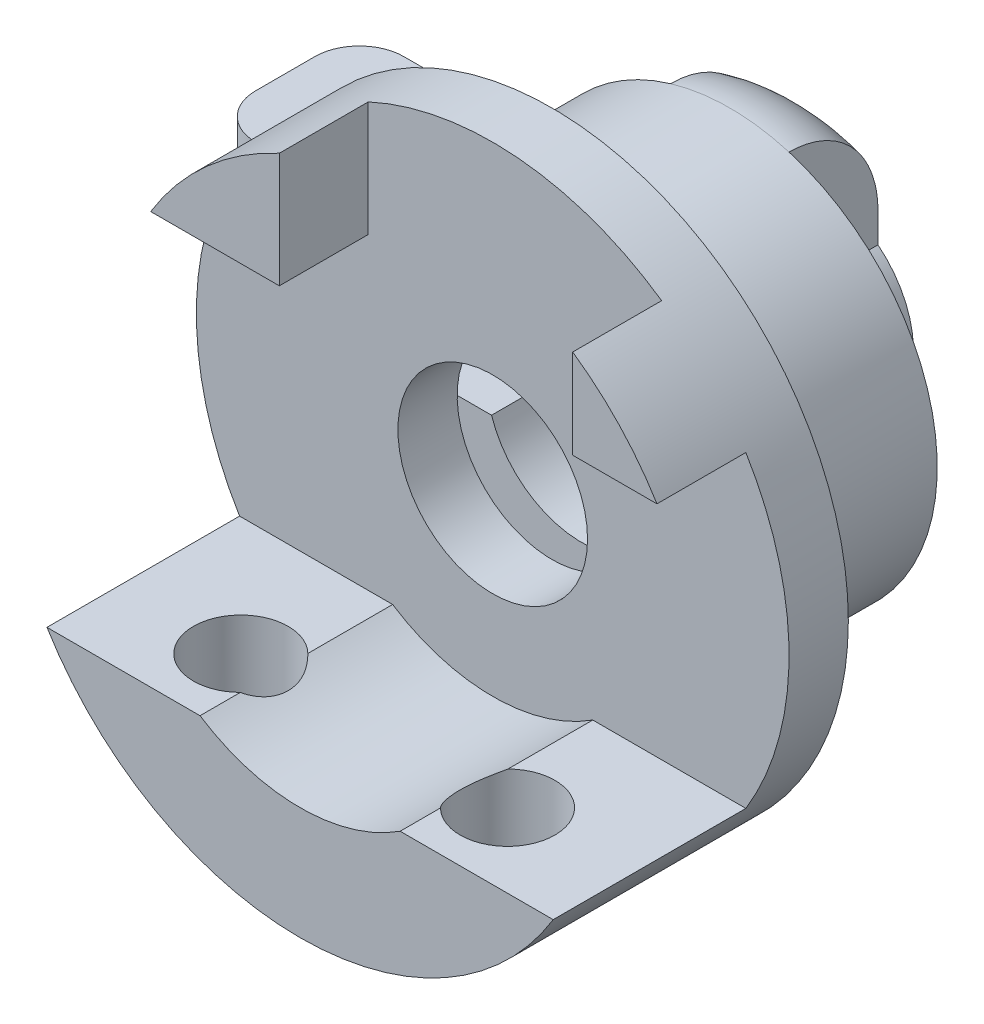
from build123d import *
from build123d.topology import SkipClean

# Parameters (mm, degrees)
SKETCH_1_R          = 10
EXTRUDE_1_DEPTH     = 2
EXTRUDE_2_DEPTH     = 3
SKETCH_3_R          = 3.2
CUT_EXTRUDE_1_DEPTH = 3
EXTRUDE_3_DEPTH     = 1
SKETCH_6_R          = 7
SKETCH_6_R_2        = 3.2
EXTRUDE_4_DEPTH     = 5
SKETCH_7_W          = 8.062767077
SKETCH_7_H          = 6
EXTRUDE_5_DEPTH     = 5
SKETCH_8_R          = 1.5
CUT_EXTRUDE_3_DEPTH = 20.006577809
CUT_EXTRUDE_4_DEPTH = 5
FILLET_7_R          = 1.5
EXTRUDE_6_DEPTH     = 3
EXTRUDE_START       = -2
SKETCH_12_R         = 3.2
EXTRUDE_7_DEPTH     = 2
FILLET_8_R          = 3
EXTRUDE_8_DEPTH     = 3.5
SKETCH_14_R         = 1.6
CUT_EXTRUDE_5_DEPTH = 22.640009284


with BuildPart() as part:
    # 草图1 → 凸台-拉伸1 (new body)
    with BuildSketch(Plane.XY):
        Circle(SKETCH_1_R)
    extrude(amount=EXTRUDE_1_DEPTH)

    # 草图2 → 凸台-拉伸2 (add)
    with SkipClean():  # the faces are left unmerged after this step: merging them gives an invalid solid
        with BuildSketch(Plane.XY.offset(2)):
            with BuildLine():
                Line((3.376388603, -5.2), (8.541662602, -5.2))
                ThreePointArc((8.541662602, -5.2), (6.403471398, -7.680856336), (3.578411207, -9.337824866))
                ThreePointArc((3.578411207, -9.337824866), (-0.425231333, -9.990954825), (-4.358898944, -9))
                ThreePointArc((-4.358898944, -9), (-6.724293423, -7.401613199), (-8.541662602, -5.2))
                Line((-8.541662602, -5.2), (-3.376388603, -5.2))
                ThreePointArc((-3.376388603, -5.2), (0, -6.2), (3.376388603, -5.2))
            make_face()
            with BuildLine():
                Line((-4.2, 5.2), (-8.541662602, 5.2))
                ThreePointArc((-8.541662602, 5.2), (-6.658968745, 7.460438007), (-4.2, 9.075241044))
                Line((-4.2, 9.075241044), (-4.2, 5.2))
            make_face()
            with BuildLine():
                Line((5.7, 5.2), (8.541662602, 5.2))
                ThreePointArc((8.541662602, 5.2), (7.278803227, 6.857041897), (5.7, 8.216446921))
                Line((5.7, 8.216446921), (5.7, 5.2))
            make_face()
        extrude(amount=EXTRUDE_2_DEPTH)

    # 草图3 → 切除-拉伸1 (cut)
    with SkipClean():  # the faces are left unmerged after this step: merging them gives an invalid solid
        with BuildSketch(Plane.XY.offset(2)):
            Circle(SKETCH_3_R)
        extrude(amount=-CUT_EXTRUDE_1_DEPTH, mode=Mode.SUBTRACT)

    # 草图5 → 凸台-拉伸3 (add)
    with SkipClean():  # the faces are left unmerged after this step: merging them gives an invalid solid
        with BuildSketch(Plane(origin=(0, 0, 0), x_dir=(-1, 0, 0), z_dir=(0, 0, -1))):
            with BuildLine():
                Line((-3.5, 6.062177826), (-3.5, 3.2))
                Line((-3.5, 3.2), (3.5, 3.2))
                Line((3.5, 3.2), (3.5, 6.062177826))
                ThreePointArc((3.5, 6.062177826), (0, 7), (-3.5, 6.062177826))
            make_face()
        extrude(amount=EXTRUDE_3_DEPTH)

    # 草图6 → 凸台-拉伸4 (add)
    with SkipClean():  # the faces are left unmerged after this step: merging them gives an invalid solid
        with BuildSketch(Plane(origin=(0, 0, -1), x_dir=(-1, 0, 0), z_dir=(0, 0, -1))):
            with Locations(Location((0, 0, 0), (0, 0, 120))):
                Circle(SKETCH_6_R)
            with Locations(Location((0, 0, 0), (0, 0, 180))):
                Circle(SKETCH_6_R_2, mode=Mode.SUBTRACT)
        extrude(amount=EXTRUDE_4_DEPTH)

    # 草图7 → 凸台-拉伸5 (add)
    with SkipClean():  # the faces are left unmerged after this step: merging them gives an invalid solid
        with BuildSketch(Plane(origin=(0, 0, -6), x_dir=(-1, 0, 0), z_dir=(0, 0, -1))):
            with Locations((8.468616461, 0)):
                Rectangle(SKETCH_7_W, SKETCH_7_H)
        extrude(amount=-EXTRUDE_5_DEPTH)

    # 草图8 → 切除-拉伸3 (cut, through all)
    with SkipClean():  # the faces are left unmerged after this step: merging them gives an invalid solid
        with BuildSketch(Plane(origin=(0, 3, 0), x_dir=(1, 0, 0), z_dir=(0, 1, 0))):
            with Locations(Location((-9.5, 3.5, 0), (0, 0, 270))):
                Circle(SKETCH_8_R)
        extrude(amount=-CUT_EXTRUDE_3_DEPTH, mode=Mode.SUBTRACT)

    # 草图9 → 切除-拉伸4 (cut)
    with SkipClean():  # the faces are left unmerged after this step: merging them gives an invalid solid
        with BuildSketch(Plane(origin=(0, 0, -6), x_dir=(-1, 0, 0), z_dir=(0, 0, -1))):
            Polygon((0, 0), (0, 1), (12.5, 1), (12.5, -1), (0, -1), align=None)
        extrude(amount=-CUT_EXTRUDE_4_DEPTH, mode=Mode.SUBTRACT)

    # 圆角7
    fillet_7_edges = [part.edges().sort_by_distance(p)[0] for p in [
        (-12.5, 2, -1),
        (-12.5, -2, -1),
        (-12.5, -2, -6),
        (-12.5, 2, -6),
    ]]
    fillet(fillet_7_edges, radius=FILLET_7_R)

    # 草图10 → 凸台-拉伸6 (add)
    with BuildSketch(Plane(origin=(0, 0, -6), x_dir=(-1, 0, 0), z_dir=(0, 0, -1))):
        with BuildLine():
            Line((2, 6.708203932), (2, 2.497999199))
            ThreePointArc((2, 2.497999199), (0, 3.2), (-2, 2.497999199))
            Line((-2, 2.497999199), (-2, 6.708203932))
            ThreePointArc((-2, 6.708203932), (0, 7), (2, 6.708203932))
        make_face()
    extrude(amount=EXTRUDE_6_DEPTH)

    # 草图12 → 凸台-拉伸7 (add)
    with BuildSketch(Plane(origin=(0, 0, -9), x_dir=(-1, 0, 0), z_dir=(0, 0, -1)).offset(EXTRUDE_START)):
        with Locations(Location((0, 0, 0), (0, 0, 180))):
            Circle(SKETCH_12_R)
    extrude(amount=EXTRUDE_7_DEPTH)

    # 圆角8
    fillet_8_edges = [part.edges().sort_by_distance(p)[0] for p in [
        (0, 7, -9),
    ]]
    fillet(fillet_8_edges, radius=FILLET_8_R - 0.0001)  # a hair under: the kernel refuses the full size

    # 草图13 → 凸台-拉伸8 (add)
    with BuildSketch(Plane.XY.offset(5)):
        with BuildLine():
            Line((3.376388603, -5.2), (8.541662602, -5.2))
            ThreePointArc((8.541662602, -5.2), (0, -10), (-8.541662602, -5.2))
            Line((-8.541662602, -5.2), (-3.376388603, -5.2))
            ThreePointArc((-3.376388603, -5.2), (0, -6.2), (3.376388603, -5.2))
        make_face()
    extrude(amount=EXTRUDE_8_DEPTH)

    # 草图14 → 切除-拉伸5 (cut, through all)
    with BuildSketch(Plane(origin=(0, -5.2, 0), x_dir=(1, 0, 0), z_dir=(0, 1, 0))):
        with Locations(Location((4.5, -6, 0), (0, 0, 270))):
            Circle(SKETCH_14_R)
        with Locations(Location((-4.5, -6, 0), (0, 0, 270))):
            Circle(SKETCH_14_R)
    extrude(amount=-CUT_EXTRUDE_5_DEPTH, mode=Mode.SUBTRACT)


solid = part.part
